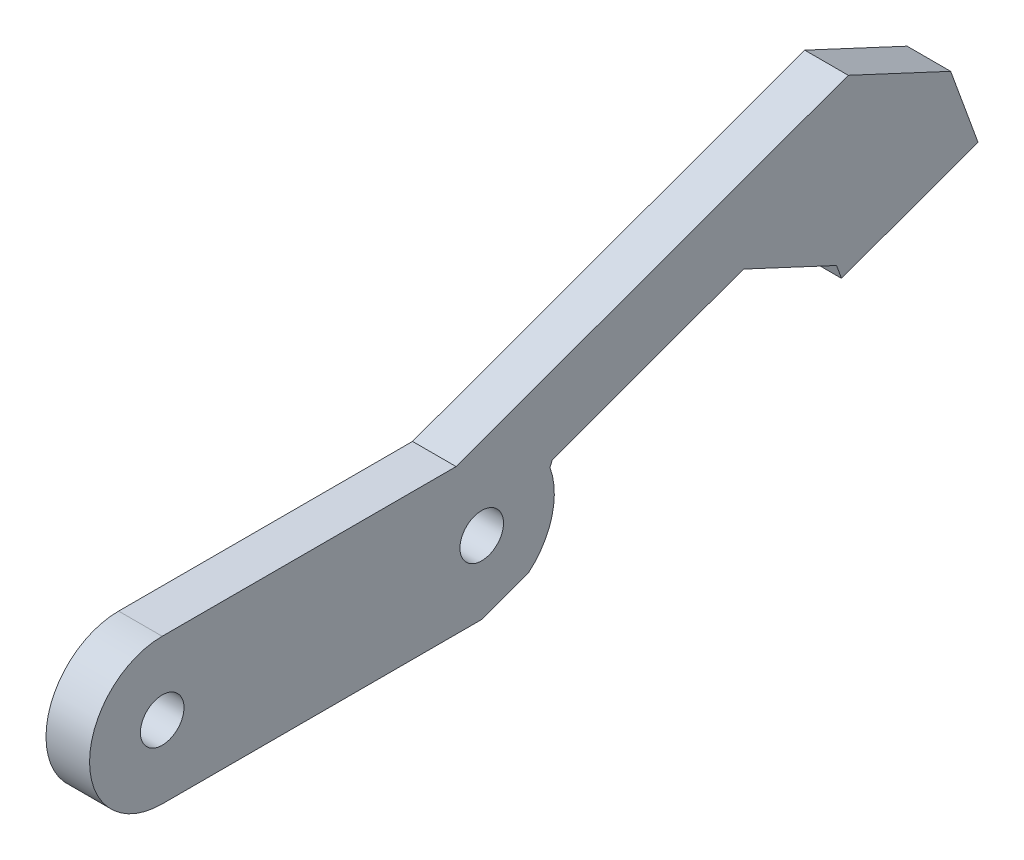
from build123d import *

# Parameters (mm, degrees)
SKETCH1_R           = 1.5
BOSS_EXTRUDE1_DEPTH = 3
BOSS_EXTRUDE2_START = -3
BOSS_EXTRUDE2_DEPTH = 3
CUT_EXTRUDE1_START  = -3
CUT_EXTRUDE1_DEPTH  = 3
CUT_EXTRUDE2_DEPTH  = 65.978416693


with BuildPart() as part:
    # Sketch1 → Boss-Extrude1 (new body)
    with BuildSketch(Plane(origin=(0, 0, 0), x_dir=(0, 0, -1), z_dir=(1, 0, 0))):
        with BuildLine():
            Line((27, 10), (5, 10))
            ThreePointArc((5, 10), (0, 5), (5, 0))
            Line((5, 0), (27, 0))
            ThreePointArc((27, 0), (32, 5), (27, 10))
        make_face()
        with Locations((5, 5)):
            Circle(SKETCH1_R, mode=Mode.SUBTRACT)
        with Locations((27, 5)):
            Circle(SKETCH1_R, mode=Mode.SUBTRACT)
    extrude(amount=BOSS_EXTRUDE1_DEPTH)

    # Sketch2 → Boss-Extrude2 (add)
    with BuildSketch(Plane(origin=(3, 0, 0), x_dir=(0, 0, -1), z_dir=(1, 0, 0)).offset(BOSS_EXTRUDE2_START)):
        with BuildLine():
            ThreePointArc((27, 10), (29.863119288, 9.099091112), (31.69447473, 6.721019177))
            Line((31.69447473, 6.721019177), (31.867747629, 7.092604107))
            Line((31.867747629, 7.092604107), (45.02344432, 11.880886114))
            Line((45.02344432, 11.880886114), (51.43200814, 8.892523726))
            Line((51.43200814, 8.892523726), (51.774028284, 7.952831106))
            Line((51.774028284, 7.952831106), (61.170954492, 11.373032539))
            Line((61.170954492, 11.373032539), (57.408732915, 21.709651368))
            Line((57.408732915, 21.709651368), (25.236730193, 10))
            Line((25.236730193, 10), (27, 10))
        make_face()
    extrude(amount=BOSS_EXTRUDE2_DEPTH)

    # Sketch3 → Cut-Extrude1 (cut)
    with BuildSketch(Plane(origin=(3, 0, 0), x_dir=(0, 0, -1), z_dir=(1, 0, 0)).offset(CUT_EXTRUDE1_START)):
        with BuildLine():
            ThreePointArc((27, 0), (28.710100717, 0.301536896), (30.213938048, 1.169777784))
            Line((30.213938048, 1.169777784), (27, 0))
        make_face()
    extrude(amount=CUT_EXTRUDE1_DEPTH, mode=Mode.SUBTRACT)

    # Sketch4 → Cut-Extrude2 (cut, through all)
    with BuildSketch(Plane(origin=(3, 0, 0), x_dir=(0, 0, -1), z_dir=(1, 0, 0))):
        Polygon((57.408732915, 21.709651368), (52.240423501, 19.828540579), (59.289843703, 16.541341953), align=None)
    extrude(amount=-CUT_EXTRUDE2_DEPTH, mode=Mode.SUBTRACT)


solid = part.part
